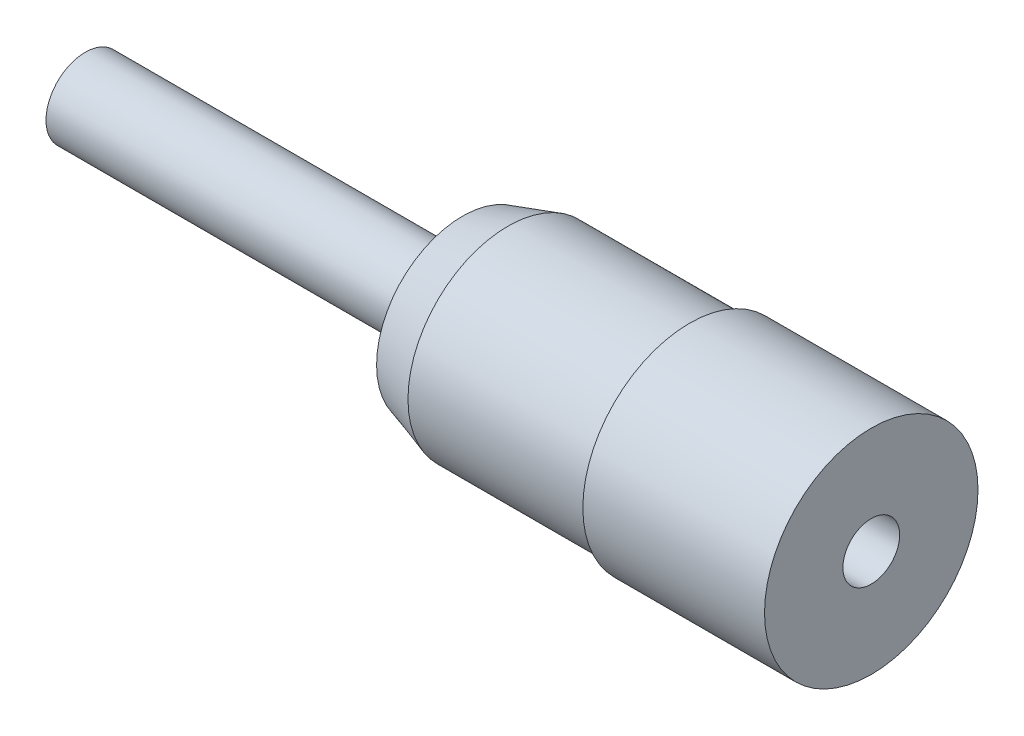
from build123d import *

# Parameters (mm, degrees)
TAP_DRILL_FOR_M3_TAP1_D     = 2.5
TAP_DRILL_FOR_M3_TAP1_DEPTH = 5.5
TAP_DRILL_FOR_M3_TAP1_TIP   = 0.751075774


with BuildPart() as part:
    # Sketch2 → Revolve4 (revolve)
    with BuildSketch(Plane.XY):
        Polygon((303.855680528, 81.106851928), (296.055680528, 81.106851928), (294.055680528, 80.488764715), (294.055680528, 80.174765167), (296.100980113, 80.806851928), (304.016235656, 80.806851928), (304.216235656, 81.106851928), (309.446915198, 81.106851928), (309.446915198, 78.436851928), (294.046915198, 78.436851928), (277.446915198, 78.436851928), (277.446915198, 76.706851928), (312.055680528, 76.706851928), (312.055680528, 79.406851928), (312.055680528, 81.406851928), (304.055680528, 81.406851928), align=None)
    revolve(axis=Axis((277.446915198, 76.706851928, 0), (1, 0, 0)))

    # Tap Drill for M3 Tap1
    with Locations(Plane(origin=(312.055680528, 0, 0), x_dir=(0, 0, -1), z_dir=(1, 0, 0))):
        with Locations((0, 76.706851928)):
            Hole(TAP_DRILL_FOR_M3_TAP1_D / 2, depth=TAP_DRILL_FOR_M3_TAP1_DEPTH)
            with Locations((0, 0, -(TAP_DRILL_FOR_M3_TAP1_DEPTH + TAP_DRILL_FOR_M3_TAP1_TIP / 2))):  # 118° drill point
                Cone(0, TAP_DRILL_FOR_M3_TAP1_D / 2, TAP_DRILL_FOR_M3_TAP1_TIP, mode=Mode.SUBTRACT)


solid = part.part
